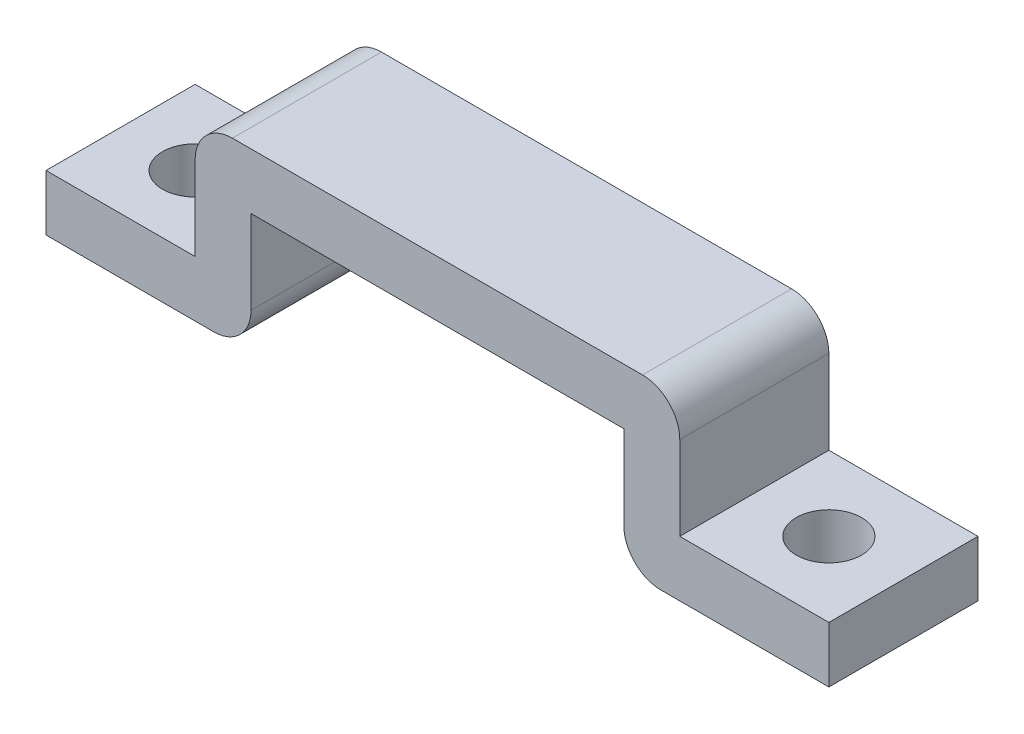
from build123d import *

# Parameters (mm, degrees)
BOSS_EXTRUDE1_DEPTH = 8
SKETCH2_R           = 1.75
CUT_EXTRUDE1_DEPTH  = 24.393375131


with BuildPart() as part:
    # Sketch1 → Boss-Extrude1 (new body)
    with BuildSketch(Plane.XY):
        with BuildLine():
            Line((-21, 0), (-12, 0))
            ThreePointArc((-12, 0), (-10.585786438, 0.585786438), (-10, 2))
            Line((-10, 2), (-10, 6.5))
            Line((-10, 6.5), (10, 6.5))
            Line((10, 6.5), (10, 2))
            ThreePointArc((10, 2), (10.585786438, 0.585786438), (12, 0))
            Line((12, 0), (21, 0))
            Line((21, 0), (21, 3))
            Line((21, 3), (13, 3))
            Line((13, 3), (13, 7.5))
            ThreePointArc((13, 7.5), (12.414213562, 8.914213562), (11, 9.5))
            Line((11, 9.5), (-11, 9.5))
            ThreePointArc((-11, 9.5), (-12.414213562, 8.914213562), (-13, 7.5))
            Line((-13, 7.5), (-13, 3))
            Line((-13, 3), (-21, 3))
            Line((-21, 3), (-21, 0))
        make_face()
    extrude(amount=BOSS_EXTRUDE1_DEPTH)

    # Sketch2 → Cut-Extrude1 (cut, through all)
    with BuildSketch(Plane(origin=(0, 3, 0), x_dir=(1, 0, 0), z_dir=(0, 1, 0))):
        with Locations((-17, -4)):
            Circle(SKETCH2_R)
        with Locations((17, -4)):
            Circle(SKETCH2_R)
    extrude(amount=-CUT_EXTRUDE1_DEPTH, mode=Mode.SUBTRACT)


solid = part.part
